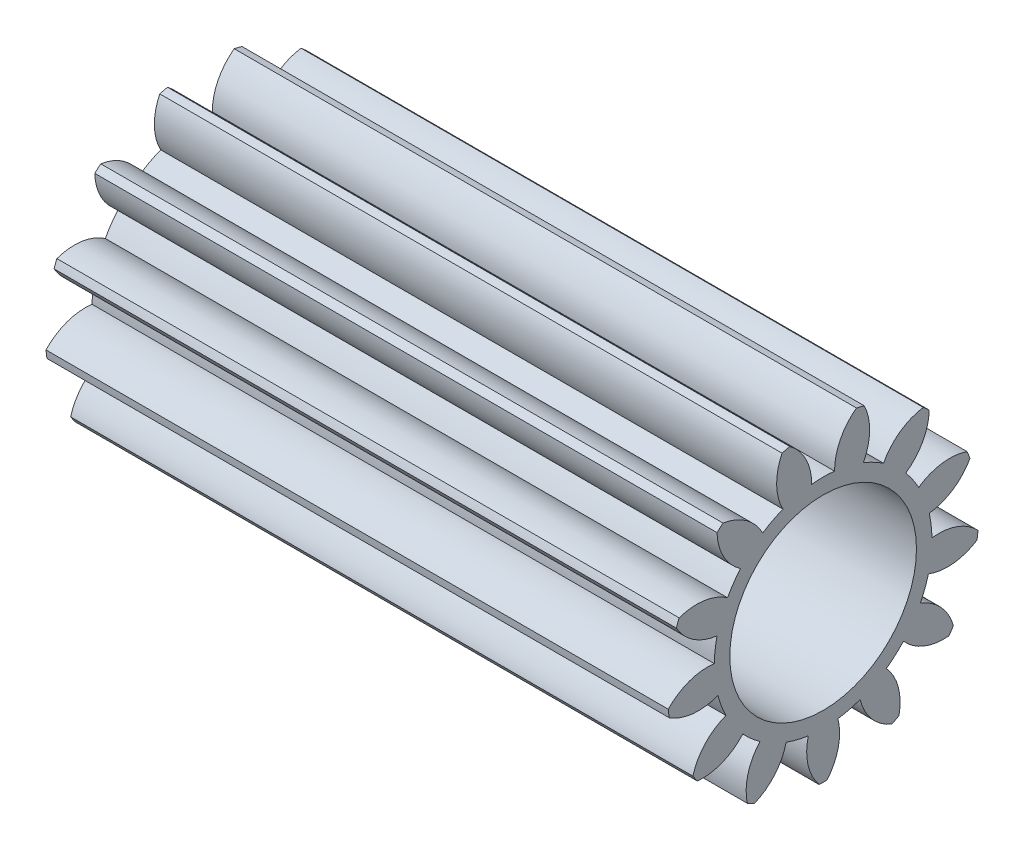
from build123d import *

# Parameters (mm, degrees)
BASPROSKE_W     = 15
BASPROSKE_H     = 3.75
TOOTHCUT_DEPTH  = 16.909902577
TEETHCUTS_COUNT = 13
TEETHCUTS_ANGLE = 332.307692308
BORSKE_R        = 2.25
BORE_DEPTH      = 50.0000508


with BuildPart() as part:
    # BasProSke → Base-Revolve (revolve)
    with BuildSketch(Plane(origin=(0, 0, 0), x_dir=(1, 0, 0), z_dir=(0, 1, 0))):
        with Locations((7.5, 1.875)):
            Rectangle(BASPROSKE_W, BASPROSKE_H)
    revolve(axis=Axis((-10, 0, 0), (1, 0, 0)))

    # TooCutSke → ToothCut (cut, through all)
    with BuildSketch(Plane(origin=(0, 0, 0), x_dir=(0, 0, -1), z_dir=(1, 0, 0))):
        with BuildLine():
            ThreePointArc((0.275247387, 2.609523879), (0, 2.624), (-0.275247387, 2.609523879))
            ThreePointArc((-0.275247387, 2.609523879), (-0.421084752, 3.214694797), (-0.831556081, 3.682683756))
            ThreePointArc((-0.831556081, 3.682683756), (0, 3.7754), (0.831556081, 3.682683756))
            ThreePointArc((0.831556081, 3.682683756), (0.421084752, 3.214694797), (0.275247387, 2.609523879))
        make_face()
    toothcut = extrude(amount=TOOTHCUT_DEPTH, mode=Mode.SUBTRACT)

    # TeethCuts: ToothCut ×13 about axis
    teethcuts_axis = Axis((-10, 0, 0), (1, 0, 0))
    for i in range(1, TEETHCUTS_COUNT):
        add(toothcut.rotate(teethcuts_axis, i * TEETHCUTS_ANGLE / (TEETHCUTS_COUNT - 1)), mode=Mode.SUBTRACT)

    # BorSke → Bore (cut, symmetric)
    with BuildSketch(Plane(origin=(0, 0, 0), x_dir=(0, 0, -1), z_dir=(1, 0, 0))):
        Circle(BORSKE_R)
    extrude(amount=BORE_DEPTH, both=True, mode=Mode.SUBTRACT)


solid = part.part
